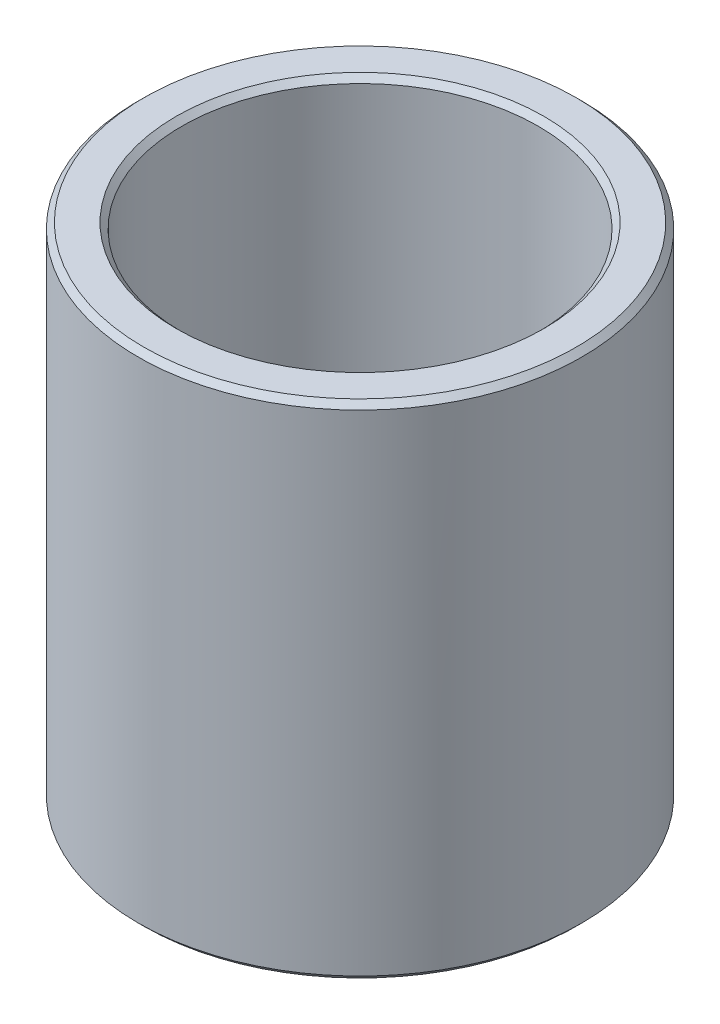
from build123d import *

# Parameters (mm, degrees)
SKETCH1_R           = 15
BOSS_EXTRUDE1_DEPTH = 33.912509315
SKETCH2_R           = 12.049389575
CUT_EXTRUDE1_DEPTH  = 41.000728594
CHAMFER1_SIZE       = 0.384864636


with BuildPart() as part:
    # Sketch1 → Boss-Extrude1 (new body)
    with BuildSketch(Plane(origin=(0, 0, 0), x_dir=(1, 0, 0), z_dir=(0, 1, 0))):
        Circle(SKETCH1_R)
    extrude(amount=BOSS_EXTRUDE1_DEPTH)

    # Sketch2 → Cut-Extrude1 (cut, through all)
    with BuildSketch(Plane(origin=(0, 0, 0), x_dir=(1, 0, 0), z_dir=(0, 1, 0))):
        Circle(SKETCH2_R)
    extrude(amount=CUT_EXTRUDE1_DEPTH, mode=Mode.SUBTRACT)

    # Chamfer1
    chamfer1_edges = [part.edges().sort_by_distance(p)[0] for p in [
        (-12.049389575, 33.912509315, 0),
        (-12.049389575, 0, 0),
        (-15, 0, 0),
        (-15, 33.912509315, 0),
    ]]
    chamfer(chamfer1_edges, length=CHAMFER1_SIZE)


solid = part.part
